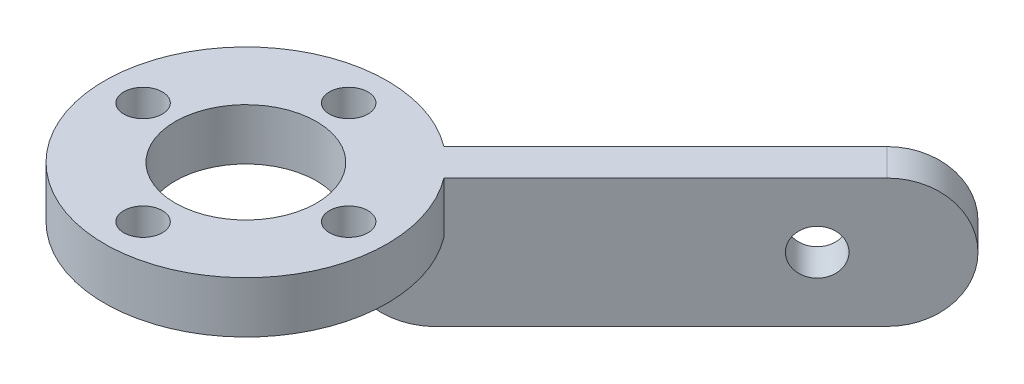
from build123d import *

# Parameters (mm, degrees)
CROQUIS1_R              = 11
CROQUIS1_R_2            = 5.5
CROQUIS1_R_3            = 1.5
SALIENTE_EXTRUIR1_DEPTH = 4
SALIENTE_EXTRUIR2_DEPTH = 10
CORTAR_EXTRUIR1_REACH   = 44.247
CROQUIS3_R              = 1.75
REDONDEO1_R             = 5


with BuildPart() as part:
    # Croquis1 → Saliente-Extruir1 (new body)
    with BuildSketch(Plane(origin=(0, 0, 0), x_dir=(1, 0, 0), z_dir=(0, 1, 0))):
        with Locations(Location((0, 0, 0), (0, 0, 270))):
            Circle(CROQUIS1_R)
        with Locations(Location((0, 0, 0), (0, 0, 270))):
            Circle(CROQUIS1_R_2, mode=Mode.SUBTRACT)
        with Locations(Location((-8, 0, 0), (0, 0, 270))):
            Circle(CROQUIS1_R_3, mode=Mode.SUBTRACT)
        with Locations(Location((0, 8, 0), (0, 0, 270))):
            Circle(CROQUIS1_R_3, mode=Mode.SUBTRACT)
        with Locations(Location((8, 0, 0), (0, 0, 270))):
            Circle(CROQUIS1_R_3, mode=Mode.SUBTRACT)
        with Locations(Location((0, -8, 0), (0, 0, 270))):
            Circle(CROQUIS1_R_3, mode=Mode.SUBTRACT)
    extrude(amount=SALIENTE_EXTRUIR1_DEPTH)

    # Croquis2 → Saliente-Extruir2 (add)
    with BuildSketch(Plane(origin=(0, 4, 0), x_dir=(1, 0, 0), z_dir=(0, 1, 0))):
        with BuildLine():
            Line((2.680997215, 4.802317559), (27.429734557, 29.5510549))
            Line((27.429734557, 29.5510549), (29.5510549, 27.429734557))
            Line((29.5510549, 27.429734557), (4.802317559, 2.680997215))
            ThreePointArc((4.802317559, 2.680997215), (3.893730418, 3.893730418), (2.680997215, 4.802317559))
        make_face()
    extrude(amount=-SALIENTE_EXTRUIR2_DEPTH)

    # Croquis3 → Cortar-Extruir1 (cut, up to next)
    with BuildSketch(Plane(origin=(-1.060660172, 0, -1.060660172), x_dir=(-0.7071067811865465, 0, 0.7071067811865486), z_dir=(-0.7071067811865486, 0, -0.7071067811865465)), mode=Mode.PRIVATE) as cortar_extruir1_sk1:
        with Locations((-31.441502622, -1)):
            Circle(CROQUIS3_R)
    cortar_extruir1_tool1 = extrude(cortar_extruir1_sk1.sketch, amount=-CORTAR_EXTRUIR1_REACH, mode=Mode.PRIVATE) & part.part
    add(cortar_extruir1_tool1.solids().sort_by_distance((21.17184, -1, -23.29316))[0], mode=Mode.SUBTRACT)

    # Redondeo1
    redondeo1_edges = [part.edges().sort_by_distance(p)[0] for p in [
        (3.893730418, -6, -3.893730418),
        (28.490394728, -6, -28.490394728),
        (28.490394728, 4, -28.490394728),
    ]]
    fillet(redondeo1_edges, radius=REDONDEO1_R - 0.0001)  # a hair under: the kernel refuses the full size


solid = part.part
